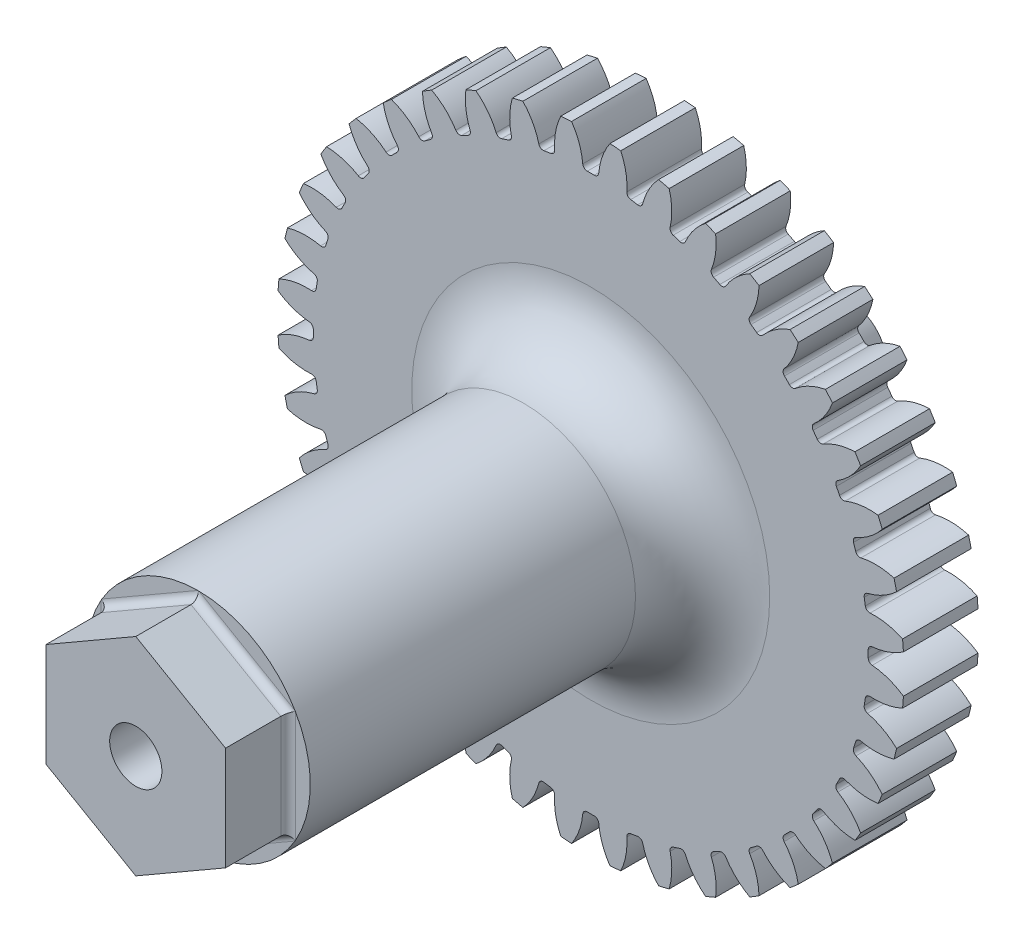
from build123d import *

# Parameters (mm, degrees)
SKETCH1_R                = 21
BOSS_EXTRUDE1_DEPTH      = 2.5
CUT_EXTRUDE1_DEPTH       = 31.116440693
FILLET1_R                = 0.3
CIRPATTERN1_COUNT        = 40
FILLET1_OF_CIRPATTERN1_R = 0.3
SKETCH4_R                = 7.5
WHEELSHAFT_DEPTH         = 26.3
SKETCH5_R                = 2.8
BOSS_EXTRUDE3_DEPTH      = 12.43
FILLET3_R                = 7.4
CHAMFER1_SIZE            = 1.5
CHAMFER1_SIZE2           = 0.401923789
FILLET4_R                = 4.5
BOSS_EXTRUDE4_DEPTH      = 4.2
SKETCH7_R                = 1.75
CUT_EXTRUDE2_DEPTH       = 7
FILLET5_R                = 0.5


with BuildPart() as part:
    # Sketch1 → Boss-Extrude1 (new, symmetric)
    with BuildSketch(Plane.XY):
        Circle(SKETCH1_R)
    extrude(amount=BOSS_EXTRUDE1_DEPTH, both=True)

    # Sketch3 → Cut-Extrude1 (cut, symmetric)
    with BuildSketch(Plane.XY.offset(2.5)):
        with BuildLine():
            ThreePointArc((-2.139593078, 21.895710572), (-0.970695217, 20.420263648), (-0.519675362, 18.592738839))
            ThreePointArc((-0.519675362, 18.592738839), (0, 18.6), (0.519675362, 18.592738839))
            ThreePointArc((0.519675362, 18.592738839), (0.970695217, 20.420263648), (2.139593078, 21.895710572))
            ThreePointArc((2.139593078, 21.895710572), (0, 22), (-2.139593078, 21.895710572))
        make_face()
    cut_extrude1 = extrude(amount=CUT_EXTRUDE1_DEPTH, both=True, mode=Mode.SUBTRACT)

    # Fillet1
    fillet1_edges = [part.edges().sort_by_distance(p)[0] for p in [
        (-0.519675362, 18.592738839, 0),
        (0.519675362, 18.592738839, 0),
    ]]
    fillet(fillet1_edges, radius=FILLET1_R)

    # CirPattern1: Cut-Extrude1 ×40 about axis
    cirpattern1_axis = Axis((0, 0, 0), (0, 0, 1))
    for i in range(1, CIRPATTERN1_COUNT):
        add(cut_extrude1.rotate(cirpattern1_axis, i * 360 / CIRPATTERN1_COUNT), mode=Mode.SUBTRACT)

    # Fillet1 of CirPattern1
    fillet1_of_cirpattern1_edges = [part.edges().sort_by_distance(p)[0] for p in [
        (-3.42182245, 18.282536233, 0),
        (-2.395267858, 18.445126508, 0),
        (-6.239712913, 17.52215691, 0),
        (-5.251231633, 17.843333947, 0),
        (-8.903960935, 16.33032393, 0),
        (-7.977892658, 16.802179285, 0),
        (-11.348963889, 14.736384178, 0),
        (-10.508111489, 15.347299206, 0),
        (-13.514517686, 12.779585741, 0),
        (-12.779585741, 13.514517686, 0),
        (-15.347299206, 10.508111489, 0),
        (-14.736384178, 11.348963889, 0),
        (-16.802179285, 7.977892658, 0),
        (-16.33032393, 8.903960935, 0),
        (-17.843333947, 5.251231633, 0),
        (-17.52215691, 6.239712913, 0),
        (-18.445126508, 2.395267858, 0),
        (-18.282536233, 3.42182245, 0),
        (-18.592738839, -0.519675362, 0),
        (-18.592738839, 0.519675362, 0),
        (-18.282536233, -3.42182245, 0),
        (-18.445126508, -2.395267858, 0),
        (-17.52215691, -6.239712913, 0),
        (-17.843333947, -5.251231633, 0),
        (-16.33032393, -8.903960935, 0),
        (-16.802179285, -7.977892658, 0),
        (-14.736384178, -11.348963889, 0),
        (-15.347299206, -10.508111489, 0),
        (-12.779585741, -13.514517686, 0),
        (-13.514517686, -12.779585741, 0),
        (-10.508111489, -15.347299206, 0),
        (-11.348963889, -14.736384178, 0),
        (-7.977892658, -16.802179285, 0),
        (-8.903960935, -16.33032393, 0),
        (-5.251231633, -17.843333947, 0),
        (-6.239712913, -17.52215691, 0),
        (-2.395267858, -18.445126508, 0),
        (-3.42182245, -18.282536233, 0),
        (0.519675362, -18.592738839, 0),
        (-0.519675362, -18.592738839, 0),
        (3.42182245, -18.282536233, 0),
        (2.395267858, -18.445126508, 0),
        (6.239712913, -17.52215691, 0),
        (5.251231633, -17.843333947, 0),
        (8.903960935, -16.33032393, 0),
        (7.977892658, -16.802179285, 0),
        (11.348963889, -14.736384178, 0),
        (10.508111489, -15.347299206, 0),
        (13.514517686, -12.779585741, 0),
        (12.779585741, -13.514517686, 0),
        (15.347299206, -10.508111489, 0),
        (14.736384178, -11.348963889, 0),
        (16.802179285, -7.977892658, 0),
        (16.33032393, -8.903960935, 0),
        (17.843333947, -5.251231633, 0),
        (17.52215691, -6.239712913, 0),
        (18.445126508, -2.395267858, 0),
        (18.282536233, -3.42182245, 0),
        (18.592738839, 0.519675362, 0),
        (18.592738839, -0.519675362, 0),
        (18.282536233, 3.42182245, 0),
        (18.445126508, 2.395267858, 0),
        (17.52215691, 6.239712913, 0),
        (17.843333947, 5.251231633, 0),
        (16.33032393, 8.903960935, 0),
        (16.802179285, 7.977892658, 0),
        (14.736384178, 11.348963889, 0),
        (15.347299206, 10.508111489, 0),
        (12.779585741, 13.514517686, 0),
        (13.514517686, 12.779585741, 0),
        (10.508111489, 15.347299206, 0),
        (11.348963889, 14.736384178, 0),
        (7.977892658, 16.802179285, 0),
        (8.903960935, 16.33032393, 0),
        (5.251231633, 17.843333947, 0),
        (6.239712913, 17.52215691, 0),
        (2.395267858, 18.445126508, 0),
        (3.42182245, 18.282536233, 0),
    ]]
    fillet(fillet1_of_cirpattern1_edges, radius=FILLET1_OF_CIRPATTERN1_R)

    # Sketch4 → Wheelshaft (add)
    with BuildSketch(Plane.XY.offset(2.5)):
        Circle(SKETCH4_R)
    extrude(amount=WHEELSHAFT_DEPTH)

    # Sketch5 → Boss-Extrude3 (add)
    with BuildSketch(Plane(origin=(0, 0, -2.5), x_dir=(-1, 0, 0), z_dir=(0, 0, -1))):
        with Locations(Location((0, 0, 0), (0, 0, 180))):
            Circle(SKETCH5_R)
    extrude(amount=BOSS_EXTRUDE3_DEPTH)

    # Fillet3
    fillet3_edges = [part.edges().sort_by_distance(p)[0] for p in [
        (-2.8, 0, -2.5),
    ]]
    fillet(fillet3_edges, radius=FILLET3_R)

    # Chamfer1
    chamfer1_edges = [part.edges().sort_by_distance(p)[0] for p in [
        (-2.8, 0, -14.93),
    ]]
    chamfer1_side = [part.faces().sort_by_distance(p)[0] for p in [
        (-2.8, 0, -12.415),
    ]]
    chamfer(chamfer1_edges, length=CHAMFER1_SIZE, length2=CHAMFER1_SIZE2, reference=chamfer1_side[0])

    # Fillet4
    fillet4_edges = [part.edges().sort_by_distance(p)[0] for p in [
        (-7.5, 0, 2.5),
    ]]
    fillet(fillet4_edges, radius=FILLET4_R)

    # Sketch6 → Boss-Extrude4 (add)
    with BuildSketch(Plane.XY.offset(28.8)):
        Polygon((0, 6.95), (-6.018876556, 3.475), (-6.018876556, -3.475), (0, -6.95), (6.018876556, -3.475), (6.018876556, 3.475), align=None)
    extrude(amount=BOSS_EXTRUDE4_DEPTH)

    # Sketch7 → Cut-Extrude2 (cut)
    with BuildSketch(Plane.XY.offset(33)):
        Circle(SKETCH7_R)
    extrude(amount=-CUT_EXTRUDE2_DEPTH, mode=Mode.SUBTRACT)

    # Fillet5
    # the kernel refuses this fillet: 0.5 mm, written as the material it adds along each edge
    with BuildSketch(Plane(origin=(7.101408311, 2.85, 28.8), x_dir=(0.4999999999999999, 0.8660254037844388, 0), z_dir=(-0.8660254037844387, 0.49999999999999983, 0))) as fillet5_piece_1_section:
        with BuildLine():
            CenterArc((FILLET5_R, -FILLET5_R), FILLET5_R, 90, 90)
            Line((0, -FILLET5_R), (0, 0))
            Line((0, 0), (FILLET5_R, 0))
        make_face()
    fillet5_piece_1 = extrude(amount=9.45, mode=Mode.PRIVATE)
    fillet5_piece_1 = split(fillet5_piece_1, bisect_by=Plane(origin=(1.588141716, 7.866914047, 28.914359858), z_dir=(0.4999999999999999, -0.8660254037844387, 0)), keep=Keep.TOP, mode=Mode.PRIVATE)
    fillet5_piece_1 = split(fillet5_piece_1, bisect_by=Plane(origin=(6.018876556, 5.308828094, 28.914359858), z_dir=(-1, 0, 0)), keep=Keep.TOP, mode=Mode.PRIVATE)
    add(fillet5_piece_1)
    with BuildSketch(Plane(origin=(1.082531755, 7.575, 28.8), x_dir=(-0.49999999999999994, 0.8660254037844388, 0), z_dir=(-0.8660254037844387, -0.4999999999999999, 0))) as fillet5_piece_2_section:
        with BuildLine():
            CenterArc((FILLET5_R, -FILLET5_R), FILLET5_R, 90, 90)
            Line((0, -FILLET5_R), (0, 0))
            Line((0, 0), (FILLET5_R, 0))
        make_face()
    fillet5_piece_2 = extrude(amount=9.45, mode=Mode.PRIVATE)
    fillet5_piece_2 = split(fillet5_piece_2, bisect_by=Plane(origin=(-1.588141716, 7.866914047, 28.914359858), z_dir=(-0.49999999999999994, -0.8660254037844389, 0)), keep=Keep.TOP, mode=Mode.PRIVATE)
    fillet5_piece_2 = split(fillet5_piece_2, bisect_by=Plane(origin=(-6.018876556, 5.308828094, 28.914359858), z_dir=(1, 0, 0)), keep=Keep.TOP, mode=Mode.PRIVATE)
    add(fillet5_piece_2)
    with BuildSketch(Plane(origin=(-6.018876556, 4.725, 28.8), x_dir=(-1, 0, 0), z_dir=(0, -1, 0))) as fillet5_piece_3_section:
        with BuildLine():
            CenterArc((FILLET5_R, -FILLET5_R), FILLET5_R, 90, 90)
            Line((0, -FILLET5_R), (0, 0))
            Line((0, 0), (FILLET5_R, 0))
        make_face()
    fillet5_piece_3 = extrude(amount=9.45, mode=Mode.PRIVATE)
    fillet5_piece_3 = split(fillet5_piece_3, bisect_by=Plane(origin=(-7.607018272, 2.558085953, 28.914359858), z_dir=(0.4999999999999999, -0.8660254037844387, 0)), keep=Keep.TOP, mode=Mode.PRIVATE)
    fillet5_piece_3 = split(fillet5_piece_3, bisect_by=Plane(origin=(-7.607018272, -2.558085953, 28.914359858), z_dir=(0.5000000000000001, 0.8660254037844386, 0)), keep=Keep.TOP, mode=Mode.PRIVATE)
    add(fillet5_piece_3)
    with BuildSketch(Plane(origin=(-7.101408311, -2.85, 28.8), x_dir=(-0.5000000000000001, -0.8660254037844386, 0), z_dir=(0.8660254037844386, -0.5000000000000001, 0))) as fillet5_piece_4_section:
        with BuildLine():
            CenterArc((FILLET5_R, -FILLET5_R), FILLET5_R, 90, 90)
            Line((0, -FILLET5_R), (0, 0))
            Line((0, 0), (FILLET5_R, 0))
        make_face()
    fillet5_piece_4 = extrude(amount=9.45, mode=Mode.PRIVATE)
    fillet5_piece_4 = split(fillet5_piece_4, bisect_by=Plane(origin=(-6.018876556, -5.308828094, 28.914359858), z_dir=(1, 0, 0)), keep=Keep.TOP, mode=Mode.PRIVATE)
    fillet5_piece_4 = split(fillet5_piece_4, bisect_by=Plane(origin=(-1.588141716, -7.866914047, 28.914359858), z_dir=(-0.49999999999999994, 0.8660254037844387, 0)), keep=Keep.TOP, mode=Mode.PRIVATE)
    add(fillet5_piece_4)
    with BuildSketch(Plane(origin=(-1.082531755, -7.575, 28.8), x_dir=(0.49999999999999994, -0.8660254037844387, 0), z_dir=(0.8660254037844387, 0.49999999999999994, 0))) as fillet5_piece_5_section:
        with BuildLine():
            CenterArc((FILLET5_R, -FILLET5_R), FILLET5_R, 90, 90)
            Line((0, -FILLET5_R), (0, 0))
            Line((0, 0), (FILLET5_R, 0))
        make_face()
    fillet5_piece_5 = extrude(amount=9.45, mode=Mode.PRIVATE)
    fillet5_piece_5 = split(fillet5_piece_5, bisect_by=Plane(origin=(1.588141716, -7.866914047, 28.914359858), z_dir=(0.5000000000000001, 0.8660254037844386, 0)), keep=Keep.TOP, mode=Mode.PRIVATE)
    fillet5_piece_5 = split(fillet5_piece_5, bisect_by=Plane(origin=(6.018876556, -5.308828094, 28.914359858), z_dir=(-1, 0, 0)), keep=Keep.TOP, mode=Mode.PRIVATE)
    add(fillet5_piece_5)
    with BuildSketch(Plane(origin=(6.018876556, -4.725, 28.8), x_dir=(1, 0, 0), z_dir=(0, 1, 0))) as fillet5_piece_6_section:
        with BuildLine():
            CenterArc((FILLET5_R, -FILLET5_R), FILLET5_R, 90, 90)
            Line((0, -FILLET5_R), (0, 0))
            Line((0, 0), (FILLET5_R, 0))
        make_face()
    fillet5_piece_6 = extrude(amount=9.45, mode=Mode.PRIVATE)
    fillet5_piece_6 = split(fillet5_piece_6, bisect_by=Plane(origin=(7.607018272, -2.558085953, 28.914359858), z_dir=(-0.49999999999999994, 0.8660254037844387, 0)), keep=Keep.TOP, mode=Mode.PRIVATE)
    fillet5_piece_6 = split(fillet5_piece_6, bisect_by=Plane(origin=(7.607018272, 2.558085953, 28.914359858), z_dir=(-0.49999999999999994, -0.8660254037844389, 0)), keep=Keep.TOP, mode=Mode.PRIVATE)
    add(fillet5_piece_6)
    with BuildSketch(Plane(origin=(6.018876556, -4.725, 28.8), x_dir=(1, 0, 0), z_dir=(0, 1, 0))) as fillet5_piece_7a_section:
        with BuildLine():
            CenterArc((FILLET5_R, -FILLET5_R), FILLET5_R, 90, 90)
            Line((0, -FILLET5_R), (0, 0))
            Line((0, 0), (FILLET5_R, 0))
        make_face()
    fillet5_piece_7a = extrude(amount=9.45, mode=Mode.PRIVATE)
    fillet5_piece_7a = fillet5_piece_7a & Plane(origin=(0, 0, 28.919805169), x_dir=(1, 0, 0), z_dir=(0, 0, -1)) * Cylinder(7.5, 21, mode=Mode.PRIVATE)
    fillet5_piece_7a = split(fillet5_piece_7a, bisect_by=Plane(origin=(5.922607004, 3.530581252, 28.919805169), z_dir=(0.49999999999999994, 0.8660254037844389, 0)), keep=Keep.TOP, mode=Mode.PRIVATE)
    with BuildSketch(Plane(origin=(7.101408311, 2.85, 28.8), x_dir=(0.4999999999999999, 0.8660254037844388, 0), z_dir=(-0.8660254037844387, 0.49999999999999983, 0))) as fillet5_piece_7b_section:
        with BuildLine():
            CenterArc((FILLET5_R, -FILLET5_R), FILLET5_R, 90, 90)
            Line((0, -FILLET5_R), (0, 0))
            Line((0, 0), (FILLET5_R, 0))
        make_face()
    fillet5_piece_7b = extrude(amount=9.45, mode=Mode.PRIVATE)
    fillet5_piece_7b = fillet5_piece_7b & Plane(origin=(0, 0, 28.919805298), x_dir=(1, 0, 0), z_dir=(0, 0, -1)) * Cylinder(7.5, 21, mode=Mode.PRIVATE)
    fillet5_piece_7b = split(fillet5_piece_7b, bisect_by=Plane(origin=(6.018876556, 3.36383753, 28.919805298), z_dir=(1, 0, 0)), keep=Keep.TOP, mode=Mode.PRIVATE)
    fillet5_piece_7 = fillet5_piece_7a & fillet5_piece_7b
    add(fillet5_piece_7)
    with BuildSketch(Plane(origin=(1.082531755, 7.575, 28.8), x_dir=(-0.49999999999999994, 0.8660254037844388, 0), z_dir=(-0.8660254037844387, -0.4999999999999999, 0))) as fillet5_piece_8a_section:
        with BuildLine():
            CenterArc((FILLET5_R, -FILLET5_R), FILLET5_R, 90, 90)
            Line((0, -FILLET5_R), (0, 0))
            Line((0, 0), (FILLET5_R, 0))
        make_face()
    fillet5_piece_8a = extrude(amount=9.45, mode=Mode.PRIVATE)
    fillet5_piece_8a = fillet5_piece_8a & Plane(origin=(0, 0, 28.919805298), x_dir=(1, 0, 0), z_dir=(0, 0, -1)) * Cylinder(7.5, 21, mode=Mode.PRIVATE)
    fillet5_piece_8a = split(fillet5_piece_8a, bisect_by=Plane(origin=(0.096269523, 6.894418765, 28.919805298), z_dir=(0.49999999999999994, 0.8660254037844389, 0)), keep=Keep.TOP, mode=Mode.PRIVATE)
    with BuildSketch(Plane(origin=(7.101408311, 2.85, 28.8), x_dir=(0.4999999999999999, 0.8660254037844388, 0), z_dir=(-0.8660254037844387, 0.49999999999999983, 0))) as fillet5_piece_8b_section:
        with BuildLine():
            CenterArc((FILLET5_R, -FILLET5_R), FILLET5_R, 90, 90)
            Line((0, -FILLET5_R), (0, 0))
            Line((0, 0), (FILLET5_R, 0))
        make_face()
    fillet5_piece_8b = extrude(amount=9.45, mode=Mode.PRIVATE)
    fillet5_piece_8b = fillet5_piece_8b & Plane(origin=(0, 0, 28.919805169), x_dir=(1, 0, 0), z_dir=(0, 0, -1)) * Cylinder(7.5, 21, mode=Mode.PRIVATE)
    fillet5_piece_8b = split(fillet5_piece_8b, bisect_by=Plane(origin=(-0.096269552, 6.894418748, 28.919805169), z_dir=(-0.4999999999999999, 0.8660254037844387, 0)), keep=Keep.TOP, mode=Mode.PRIVATE)
    fillet5_piece_8 = fillet5_piece_8a & fillet5_piece_8b
    add(fillet5_piece_8)
    with BuildSketch(Plane(origin=(1.082531755, 7.575, 28.8), x_dir=(-0.49999999999999994, 0.8660254037844388, 0), z_dir=(-0.8660254037844387, -0.4999999999999999, 0))) as fillet5_piece_9a_section:
        with BuildLine():
            CenterArc((FILLET5_R, -FILLET5_R), FILLET5_R, 90, 90)
            Line((0, -FILLET5_R), (0, 0))
            Line((0, 0), (FILLET5_R, 0))
        make_face()
    fillet5_piece_9a = extrude(amount=9.45, mode=Mode.PRIVATE)
    fillet5_piece_9a = fillet5_piece_9a & Plane(origin=(0, 0, 28.919805169), x_dir=(1, 0, 0), z_dir=(0, 0, -1)) * Cylinder(7.5, 21, mode=Mode.PRIVATE)
    fillet5_piece_9a = split(fillet5_piece_9a, bisect_by=Plane(origin=(-6.018876556, 3.363837496, 28.919805169), z_dir=(-1, 0, 0)), keep=Keep.TOP, mode=Mode.PRIVATE)
    with BuildSketch(Plane(origin=(-6.018876556, 4.725, 28.8), x_dir=(-1, 0, 0), z_dir=(0, -1, 0))) as fillet5_piece_9b_section:
        with BuildLine():
            CenterArc((FILLET5_R, -FILLET5_R), FILLET5_R, 90, 90)
            Line((0, -FILLET5_R), (0, 0))
            Line((0, 0), (FILLET5_R, 0))
        make_face()
    fillet5_piece_9b = extrude(amount=9.45, mode=Mode.PRIVATE)
    fillet5_piece_9b = fillet5_piece_9b & Plane(origin=(0, 0, 28.919805298), x_dir=(1, 0, 0), z_dir=(0, 0, -1)) * Cylinder(7.5, 21, mode=Mode.PRIVATE)
    fillet5_piece_9b = split(fillet5_piece_9b, bisect_by=Plane(origin=(-5.922607033, 3.530581235, 28.919805298), z_dir=(-0.4999999999999999, 0.8660254037844387, 0)), keep=Keep.TOP, mode=Mode.PRIVATE)
    fillet5_piece_9 = fillet5_piece_9a & fillet5_piece_9b
    add(fillet5_piece_9)
    with BuildSketch(Plane(origin=(-6.018876556, 4.725, 28.8), x_dir=(-1, 0, 0), z_dir=(0, -1, 0))) as fillet5_piece_10a_section:
        with BuildLine():
            CenterArc((FILLET5_R, -FILLET5_R), FILLET5_R, 90, 90)
            Line((0, -FILLET5_R), (0, 0))
            Line((0, 0), (FILLET5_R, 0))
        make_face()
    fillet5_piece_10a = extrude(amount=9.45, mode=Mode.PRIVATE)
    fillet5_piece_10a = fillet5_piece_10a & Plane(origin=(0, 0, 28.919805169), x_dir=(1, 0, 0), z_dir=(0, 0, -1)) * Cylinder(7.5, 21, mode=Mode.PRIVATE)
    fillet5_piece_10a = split(fillet5_piece_10a, bisect_by=Plane(origin=(-5.922607004, -3.530581252, 28.919805169), z_dir=(-0.5000000000000001, -0.8660254037844386, 0)), keep=Keep.TOP, mode=Mode.PRIVATE)
    with BuildSketch(Plane(origin=(-7.101408311, -2.85, 28.8), x_dir=(-0.5000000000000001, -0.8660254037844386, 0), z_dir=(0.8660254037844386, -0.5000000000000001, 0))) as fillet5_piece_10b_section:
        with BuildLine():
            CenterArc((FILLET5_R, -FILLET5_R), FILLET5_R, 90, 90)
            Line((0, -FILLET5_R), (0, 0))
            Line((0, 0), (FILLET5_R, 0))
        make_face()
    fillet5_piece_10b = extrude(amount=9.45, mode=Mode.PRIVATE)
    fillet5_piece_10b = fillet5_piece_10b & Plane(origin=(0, 0, 28.919805298), x_dir=(1, 0, 0), z_dir=(0, 0, -1)) * Cylinder(7.5, 21, mode=Mode.PRIVATE)
    fillet5_piece_10b = split(fillet5_piece_10b, bisect_by=Plane(origin=(-6.018876556, -3.36383753, 28.919805298), z_dir=(-1, 0, 0)), keep=Keep.TOP, mode=Mode.PRIVATE)
    fillet5_piece_10 = fillet5_piece_10a & fillet5_piece_10b
    add(fillet5_piece_10)
    with BuildSketch(Plane(origin=(-7.101408311, -2.85, 28.8), x_dir=(-0.5000000000000001, -0.8660254037844386, 0), z_dir=(0.8660254037844386, -0.5000000000000001, 0))) as fillet5_piece_11a_section:
        with BuildLine():
            CenterArc((FILLET5_R, -FILLET5_R), FILLET5_R, 90, 90)
            Line((0, -FILLET5_R), (0, 0))
            Line((0, 0), (FILLET5_R, 0))
        make_face()
    fillet5_piece_11a = extrude(amount=9.45, mode=Mode.PRIVATE)
    fillet5_piece_11a = fillet5_piece_11a & Plane(origin=(0, 0, 28.919805169), x_dir=(1, 0, 0), z_dir=(0, 0, -1)) * Cylinder(7.5, 21, mode=Mode.PRIVATE)
    fillet5_piece_11a = split(fillet5_piece_11a, bisect_by=Plane(origin=(0.096269552, -6.894418748, 28.919805169), z_dir=(0.49999999999999994, -0.8660254037844387, 0)), keep=Keep.TOP, mode=Mode.PRIVATE)
    with BuildSketch(Plane(origin=(-1.082531755, -7.575, 28.8), x_dir=(0.49999999999999994, -0.8660254037844387, 0), z_dir=(0.8660254037844387, 0.49999999999999994, 0))) as fillet5_piece_11b_section:
        with BuildLine():
            CenterArc((FILLET5_R, -FILLET5_R), FILLET5_R, 90, 90)
            Line((0, -FILLET5_R), (0, 0))
            Line((0, 0), (FILLET5_R, 0))
        make_face()
    fillet5_piece_11b = extrude(amount=9.45, mode=Mode.PRIVATE)
    fillet5_piece_11b = fillet5_piece_11b & Plane(origin=(0, 0, 28.919805298), x_dir=(1, 0, 0), z_dir=(0, 0, -1)) * Cylinder(7.5, 21, mode=Mode.PRIVATE)
    fillet5_piece_11b = split(fillet5_piece_11b, bisect_by=Plane(origin=(-0.096269523, -6.894418765, 28.919805298), z_dir=(-0.5000000000000001, -0.8660254037844386, 0)), keep=Keep.TOP, mode=Mode.PRIVATE)
    fillet5_piece_11 = fillet5_piece_11a & fillet5_piece_11b
    add(fillet5_piece_11)
    with BuildSketch(Plane(origin=(-1.082531755, -7.575, 28.8), x_dir=(0.49999999999999994, -0.8660254037844387, 0), z_dir=(0.8660254037844387, 0.49999999999999994, 0))) as fillet5_piece_12a_section:
        with BuildLine():
            CenterArc((FILLET5_R, -FILLET5_R), FILLET5_R, 90, 90)
            Line((0, -FILLET5_R), (0, 0))
            Line((0, 0), (FILLET5_R, 0))
        make_face()
    fillet5_piece_12a = extrude(amount=9.45, mode=Mode.PRIVATE)
    fillet5_piece_12a = fillet5_piece_12a & Plane(origin=(0, 0, 28.919805169), x_dir=(1, 0, 0), z_dir=(0, 0, -1)) * Cylinder(7.5, 21, mode=Mode.PRIVATE)
    fillet5_piece_12a = split(fillet5_piece_12a, bisect_by=Plane(origin=(6.018876556, -3.363837496, 28.919805169), z_dir=(1, 0, 0)), keep=Keep.TOP, mode=Mode.PRIVATE)
    with BuildSketch(Plane(origin=(6.018876556, -4.725, 28.8), x_dir=(1, 0, 0), z_dir=(0, 1, 0))) as fillet5_piece_12b_section:
        with BuildLine():
            CenterArc((FILLET5_R, -FILLET5_R), FILLET5_R, 90, 90)
            Line((0, -FILLET5_R), (0, 0))
            Line((0, 0), (FILLET5_R, 0))
        make_face()
    fillet5_piece_12b = extrude(amount=9.45, mode=Mode.PRIVATE)
    fillet5_piece_12b = fillet5_piece_12b & Plane(origin=(0, 0, 28.919805298), x_dir=(1, 0, 0), z_dir=(0, 0, -1)) * Cylinder(7.5, 21, mode=Mode.PRIVATE)
    fillet5_piece_12b = split(fillet5_piece_12b, bisect_by=Plane(origin=(5.922607033, -3.530581235, 28.919805298), z_dir=(0.49999999999999994, -0.8660254037844387, 0)), keep=Keep.TOP, mode=Mode.PRIVATE)
    fillet5_piece_12 = fillet5_piece_12a & fillet5_piece_12b
    add(fillet5_piece_12)


solid = part.part
